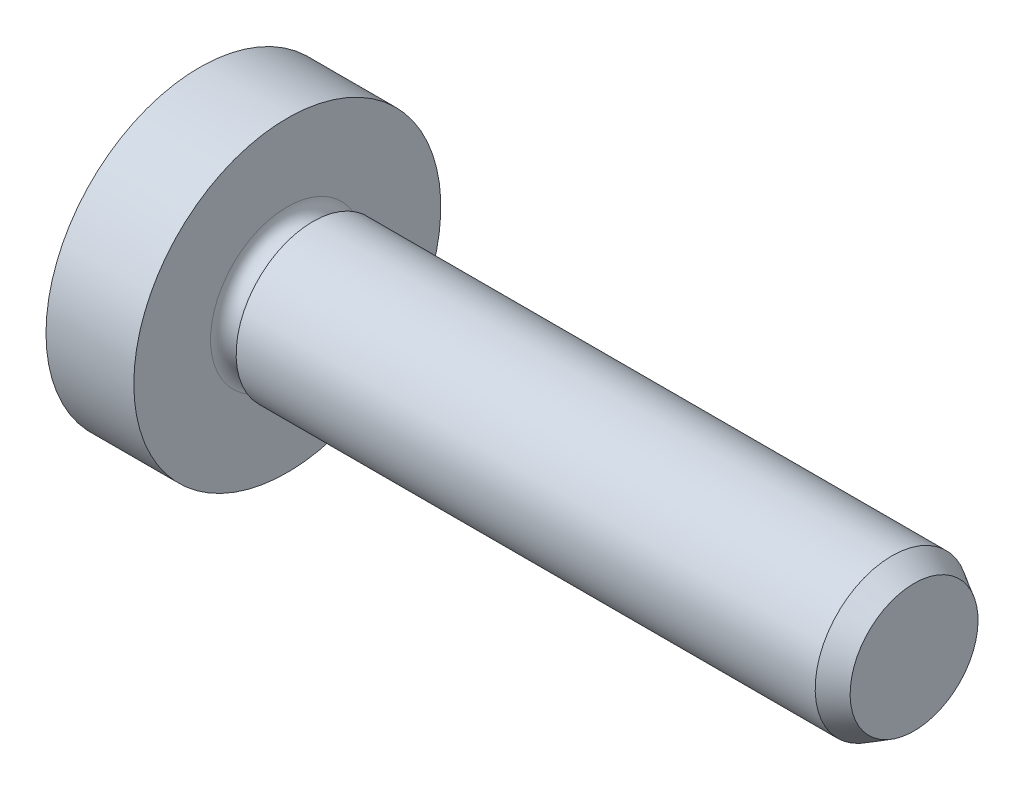
from build123d import *

# Parameters (mm, degrees)
CROSSRECESS_DEPTH = 3.1
DRAFT1_ANGLE      = -30


with BuildPart() as part:
    # Sketch1 → Base (revolve)
    with BuildSketch(Plane.XY):
        with BuildLine():
            Line((29.1, 0), (29.1, 3))
            Line((29.1, 3), (4.6, 3))
            Line((4.6, 3), (4.6, 6))
            Line((4.6, 6), (1.167603026, 6))
            ThreePointArc((1.167603026, 6), (0.29461316, 3.056276199), (0, 0))
            Line((0, 0), (29.1, 0))
        make_face()
    revolve(axis=Axis((-96.385195531, 0, 0), (1, 0, 0)))

    # Sketch2 → CrossRecess (cut)
    with BuildSketch(Plane(origin=(0, 0, 0), x_dir=(0, 0, -1), z_dir=(1, 0, 0))):
        Polygon((-0.69, 3.45), (0.69, 3.45), (0.69, 0.69), (3.45, 0.69), (3.45, -0.69), (0.69, -0.69), (0.69, -3.45), (-0.69, -3.45), (-0.69, -0.69), (-3.45, -0.69), (-3.45, 0.69), (-0.69, 0.69), align=None)
    extrude(amount=CROSSRECESS_DEPTH, mode=Mode.SUBTRACT)

    # Draft1
    draft1_faces = [part.faces().sort_by_distance(p)[0] for p in [
        (1.7407264, 0, 3.45),
        (1.7407264, 3.45, 0),
        (1.7407264, 0, -3.45),
        (1.7407264, -3.45, 0),
    ]]
    draft(draft1_faces, Plane(origin=(0, 0, 0), x_dir=(0, 0, 1), z_dir=(1, 0, 0)), DRAFT1_ANGLE)

    # Sketch6 → BaseEnd (revolve, cut)
    with BuildSketch(Plane.XY):
        Polygon((28.233974596, -3), (29.1, -2.5), (29.1, -3), align=None)
    revolve(axis=Axis((30.948266523, 0, 0), (-1, 0, 0)), mode=Mode.SUBTRACT)

    # Sketch4 → Cut-Revolve2 (revolve, cut)
    with BuildSketch(Plane(origin=(0, 0, 0), x_dir=(1, 0, 0), z_dir=(0, 1, 0))):
        with BuildLine():
            Line((4.6, 3), (5.6, 3))
            ThreePointArc((5.6, 3), (5.1, 2.5), (4.6, 3))
        make_face()
    revolve(axis=Axis((14.876032399, 0, 0), (-1, 0, 0)), mode=Mode.SUBTRACT)


solid = part.part
